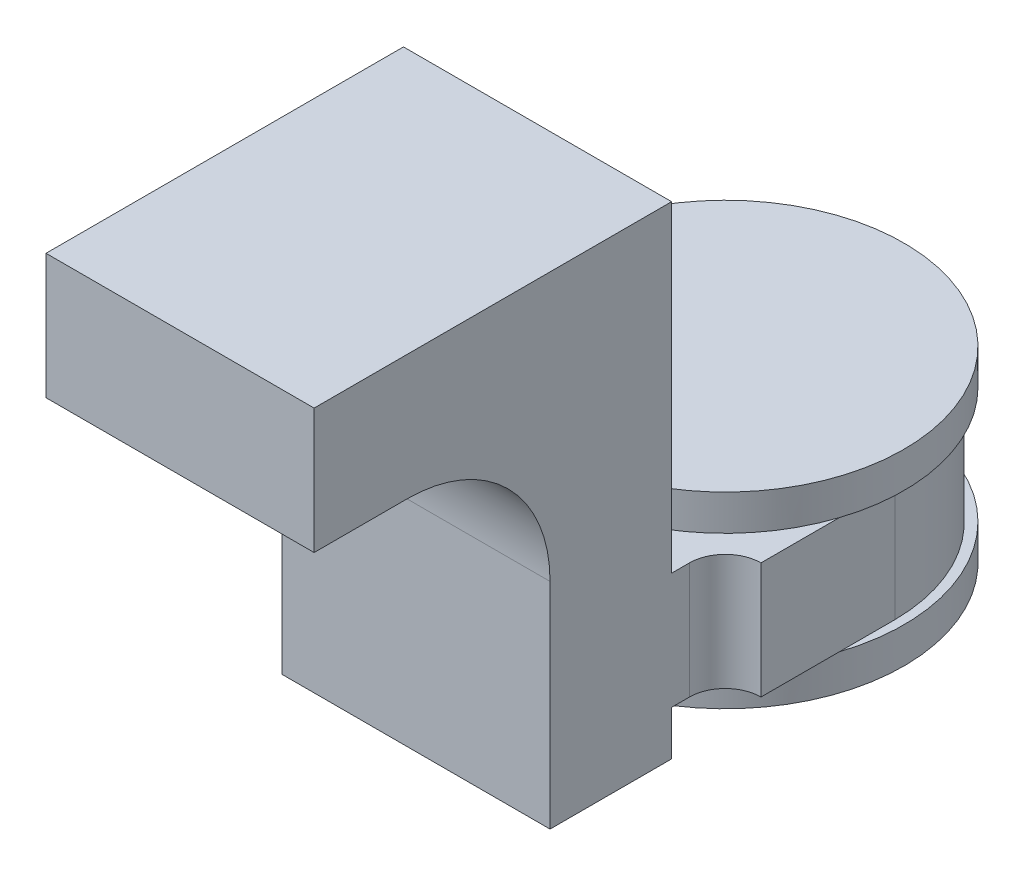
from build123d import *

# Parameters (mm, degrees)
EXTRUDE_2_DEPTH     = 6.5
SKETCH_3_R          = 10
EXTRUDE_3_DEPTH     = 2
EXTRUDE_START       = 2
SKETCH_4_R          = 10
EXTRUDE_4_DEPTH     = 2
SKETCH_5_R          = 5
EXTRUDE_5_DEPTH     = 1.5
SKETCH_8_W          = 6
SKETCH_8_H          = 6.5
CUT_EXTRUDE_2_DEPTH = 0.94
SKETCH_9_W          = 6
SKETCH_9_H          = 6.5
CUT_EXTRUDE_3_DEPTH = 0.94
FILLET_4_R          = 2
SKETCH_10_W         = 15
SKETCH_10_H         = 2.5
EXTRUDE_6_DEPTH     = 6.8
SKETCH_11_W         = 15
SKETCH_11_H         = 18
SKETCH_11_H_2       = 6.5
EXTRUDE_7_DEPTH     = 6.8
SKETCH_12_W         = 15
SKETCH_12_H         = 7
EXTRUDE_8_DEPTH     = 13.2
SKETCH_16_W         = 15
SKETCH_16_H         = 18
SKETCH_16_H_2       = 2.5
EXTRUDE_10_DEPTH    = 3
SKETCH_17_W         = 15
SKETCH_17_H         = 20
CUT_EXTRUDE_6_DEPTH = 3
SKETCH_18_W         = 15
SKETCH_18_H         = 7
CUT_EXTRUDE_7_DEPTH = 3
FILLET_7_R          = 8


with BuildPart() as part:
    # ｽｹｯﾁ1 → ﾎﾞｽ - 押し出し2 (new body)
    with BuildSketch(Plane(origin=(0, 0, 0), x_dir=(1, 0, 0), z_dir=(0, 1, 0))):
        with BuildLine():
            Line((-9.5, 0), (-9.5, -7.5))
            Line((-9.5, -7.5), (-8.44, -7.5))
            Line((-8.44, -7.5), (-8.44, -13.5))
            Line((-8.44, -13.5), (8.44, -13.5))
            Line((8.44, -13.5), (8.44, -7.5))
            Line((8.44, -7.5), (9.5, -7.5))
            Line((9.5, -7.5), (9.5, 0))
            ThreePointArc((9.5, 0), (0, 9.438928409), (-9.5, 0))
        make_face()
    extrude(amount=EXTRUDE_2_DEPTH)

    # ｽｹｯﾁ3 → ﾎﾞｽ - 押し出し3 (add)
    with BuildSketch(Plane(origin=(0, 6.5, 0), x_dir=(1, 0, 0), z_dir=(0, 1, 0))):
        with Locations(Location((0, 0, 0), (0, 0, 198.194872339))):
            Circle(SKETCH_3_R)
    extrude(amount=EXTRUDE_3_DEPTH)

    # ｽｹｯﾁ4 → ﾎﾞｽ - 押し出し4 (add)
    with BuildSketch(Plane.XZ.offset(EXTRUDE_START)):
        with Locations(Location((0, 0, 0), (0, 0, 161.805127661))):
            Circle(SKETCH_4_R)
    extrude(amount=-EXTRUDE_4_DEPTH)

    # ｽｹｯﾁ5 → ﾎﾞｽ - 押し出し5 (add)
    with BuildSketch(Plane.XZ.offset(2)):
        with Locations(Location((0, 0, 0), (0, 0, 270))):
            Circle(SKETCH_5_R)
    extrude(amount=EXTRUDE_5_DEPTH)

    # ｽｹｯﾁ8 → ｶｯﾄ - 押し出し2 (cut)
    with BuildSketch(Plane(origin=(8.44, 0, 0), x_dir=(0, 0, -1), z_dir=(1, 0, 0))):
        with Locations((-10.5, 3.25)):
            Rectangle(SKETCH_8_W, SKETCH_8_H)
    extrude(amount=-CUT_EXTRUDE_2_DEPTH, mode=Mode.SUBTRACT)

    # ｽｹｯﾁ9 → ｶｯﾄ - 押し出し3 (cut)
    with BuildSketch(Plane.ZY.offset(8.44)):
        with Locations((10.5, 3.25)):
            Rectangle(SKETCH_9_W, SKETCH_9_H)
    extrude(amount=-CUT_EXTRUDE_3_DEPTH, mode=Mode.SUBTRACT)

    # ﾌｨﾚｯﾄ4
    fillet_4_edges = [part.edges().sort_by_distance(p)[0] for p in [
        (7.5, 3.25, 7.5),
        (-7.5, 3.25, 7.5),
    ]]
    fillet(fillet_4_edges, radius=FILLET_4_R - 0.0001)  # a hair under: the kernel refuses the full size



with BuildPart() as body_2:
    # ｽｹｯﾁ10 → ﾎﾞｽ - 押し出し6 (new body)
    with BuildSketch(Plane.XY.offset(13.5)):
        with Locations((0, -1.25)):
            Rectangle(SKETCH_10_W, SKETCH_10_H)
    extrude(amount=EXTRUDE_6_DEPTH)


with BuildPart() as part_1:
    add(part.part)

    add(body_2.part)  # ﾎﾞｽ - 押し出し7 merges body 2
    # ｽｹｯﾁ11 → ﾎﾞｽ - 押し出し7 (add)
    with BuildSketch(Plane.XY.offset(13.5)):
        with Locations((0, 15.5)):
            Rectangle(SKETCH_11_W, SKETCH_11_H)
        with Locations((0, 3.25)):
            Rectangle(SKETCH_11_W, SKETCH_11_H_2)
    extrude(amount=EXTRUDE_7_DEPTH)

    # ｽｹｯﾁ12 → ﾎﾞｽ - 押し出し8 (add)
    with BuildSketch(Plane.XY.offset(20.3)):
        with Locations((0, 21)):
            Rectangle(SKETCH_12_W, SKETCH_12_H)
    extrude(amount=EXTRUDE_8_DEPTH)

    # ｽｹｯﾁ16 → ﾎﾞｽ - 押し出し10 (add)
    with BuildSketch(Plane(origin=(0, 0, 13.5), x_dir=(-1, 0, 0), z_dir=(0, 0, -1))):
        with Locations((0, 15.5)):
            Rectangle(SKETCH_16_W, SKETCH_16_H)
        with Locations((0, -1.25)):
            Rectangle(SKETCH_16_W, SKETCH_16_H_2)
    extrude(amount=EXTRUDE_10_DEPTH)

    # ｽｹｯﾁ17 → ｶｯﾄ - 押し出し6 (cut)
    with BuildSketch(Plane.XY.offset(20.3)):
        with Locations((0, 7.5)):
            Rectangle(SKETCH_17_W, SKETCH_17_H)
    extrude(amount=-CUT_EXTRUDE_6_DEPTH, mode=Mode.SUBTRACT)

    # ｽｹｯﾁ18 → ｶｯﾄ - 押し出し7 (cut)
    with BuildSketch(Plane.XY.offset(33.5)):
        with Locations((0, 21)):
            Rectangle(SKETCH_18_W, SKETCH_18_H)
    extrude(amount=-CUT_EXTRUDE_7_DEPTH, mode=Mode.SUBTRACT)

    # ﾌｨﾚｯﾄ7
    fillet_7_edges = [part_1.edges().sort_by_distance(p)[0] for p in [
        (0, 17.5, 17.3),
    ]]
    fillet(fillet_7_edges, radius=FILLET_7_R)


solid = part_1.part
